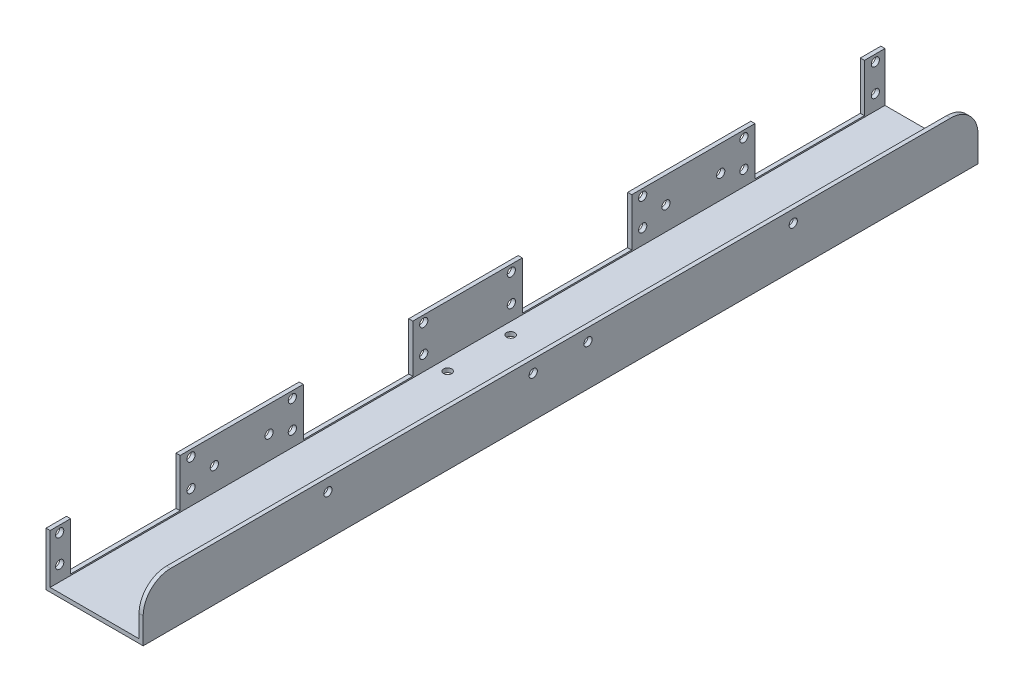
from build123d import *

# Parameters (mm, degrees)
EXTRU_MINCE1_DEPTH      = 152.5
CONG_1_R                = 10
ESQUISSE2_R             = 1.5
ENL_V_MAT_EXTRU_1_DEPTH = 2
ESQUISSE3_R             = 1.5
ESQUISSE3_W             = 40
ESQUISSE3_H             = 17.5
ENL_V_MAT_EXTRU_2_DEPTH = 2
ESQUISSE4_R             = 1.5
ENL_V_MAT_EXTRU_3_DEPTH = 2
ESQUISSE5_R             = 1.5
ENL_V_MAT_EXTRU_4_DEPTH = 3


with BuildPart() as part:
    # Esquisse1 → Extru.-Mince1 (new, symmetric)
    with BuildSketch(Plane.XY):
        Polygon((-17.75, 19.5), (-17.75, 0), (17.75, 0), (17.75, 19.5), (16.25, 19.5), (16.25, 1.5), (-16.25, 1.5), (-16.25, 19.5), align=None)
    extrude(amount=EXTRU_MINCE1_DEPTH, both=True)

    # Congé1
    cong_1_edges = [part.edges().sort_by_distance(p)[0] for p in [
        (17, 19.5, 152.5),
        (17, 19.5, -152.5),
    ]]
    fillet(cong_1_edges, radius=CONG_1_R)

    # Esquisse2 → Enlèv. mat.-Extru.1 (cut)
    with BuildSketch(Plane.XZ):
        with Locations((-12, 11.5)):
            Circle(ESQUISSE2_R)
        with Locations((12, 11.5)):
            Circle(ESQUISSE2_R)
        with Locations((12, -11.5)):
            Circle(ESQUISSE2_R)
        with Locations((-12, -11.5)):
            Circle(ESQUISSE2_R)
    extrude(amount=-ENL_V_MAT_EXTRU_1_DEPTH, mode=Mode.SUBTRACT)

    # Esquisse3 → Enlèv. mat.-Extru.2 (cut)
    with BuildSketch(Plane.ZY.offset(17.75)):
        with Locations((-149, 17)):
            Circle(ESQUISSE3_R)
        with Locations((-149, 7)):
            Circle(ESQUISSE3_R)
        with Locations((-101, 17)):
            Circle(ESQUISSE3_R)
        with Locations((-101, 7)):
            Circle(ESQUISSE3_R)
        with Locations((-16, 17)):
            Circle(ESQUISSE3_R)
        with Locations((-16, 7)):
            Circle(ESQUISSE3_R)
        with Locations((-64, 17)):
            Circle(ESQUISSE3_R)
        with Locations((-64, 7)):
            Circle(ESQUISSE3_R)
        with Locations((-92.5, 10)):
            Circle(ESQUISSE3_R)
        with Locations((-72.5, 10)):
            Circle(ESQUISSE3_R)
        with Locations((-125, 10.75)):
            Rectangle(ESQUISSE3_W, ESQUISSE3_H)
        with Locations((-40, 10.75)):
            Rectangle(ESQUISSE3_W, ESQUISSE3_H)
    enl_v_mat_extru_2 = extrude(amount=-ENL_V_MAT_EXTRU_2_DEPTH, mode=Mode.SUBTRACT)

    # Symétrie1: Enlèv. mat.-Extru.2 across plane
    add(enl_v_mat_extru_2.mirror(Plane.XY), mode=Mode.SUBTRACT)

    # Esquisse4 → Enlèv. mat.-Extru.3 (cut)
    with BuildSketch(Plane(origin=(0, 1.5, 0), x_dir=(1, 0, 0), z_dir=(0, 1, 0))):
        with Locations((12, -24)):
            Circle(ESQUISSE4_R)
    extrude(amount=-ENL_V_MAT_EXTRU_3_DEPTH, mode=Mode.SUBTRACT)

    # Esquisse5 → Enlèv. mat.-Extru.4 (cut)
    with BuildSketch(Plane(origin=(17.75, 0, 0), x_dir=(0, 0, -1), z_dir=(1, 0, 0))):
        with Locations((10, 15)):
            Circle(ESQUISSE5_R)
        with Locations((85, 15)):
            Circle(ESQUISSE5_R)
        with Locations((-85, 15)):
            Circle(ESQUISSE5_R)
        with Locations((-10, 15)):
            Circle(ESQUISSE5_R)
    extrude(amount=-ENL_V_MAT_EXTRU_4_DEPTH, mode=Mode.SUBTRACT)


solid = part.part
